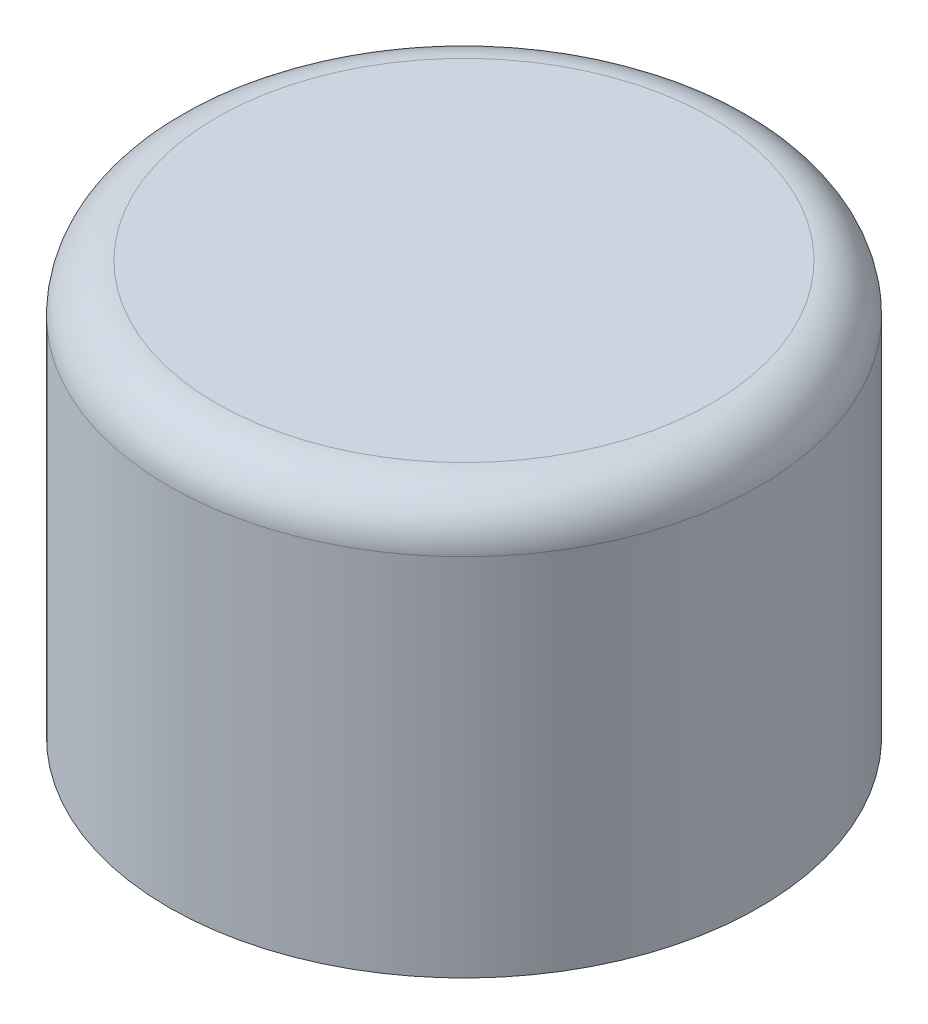
from build123d import *

# Parameters (mm, degrees)
SKETCH7_R           = 10.735
BASE_FLANGE1_DEPTH  = 1
SKETCH17_R          = 4
SKETCH17_R_2        = 2.5
BOSS_EXTRUDE1_DEPTH = 4


# Read off the part's stored shape, not the designer's step: Edge-Flange1
# Sheet-metal steps are written as plain solids
with BuildPart() as part:
    # Sketch7 → Base-Flange1 (new body)
    with BuildSketch(Plane(origin=(0, 0, 0), x_dir=(1, 0, 0), z_dir=(0, 1, 0))):
        with Locations(Location((0, 0, 0), (0, 0, 270))):
            Circle(SKETCH7_R)
    extrude(amount=-BASE_FLANGE1_DEPTH)

    # Edge-Flange1 outline → Edge-Flange1 (revolve, cut)
    with BuildSketch(Plane.XY):
        with BuildLine():
            Line((10.57104109, -1), (10.735, -1))
            Line((10.735, -1), (10.735, 0))
            Line((10.735, 0), (8.9984, 0))
            ThreePointArc((8.9984, 0), (9.930226164, -0.271171885), (10.57104109, -1))
        make_face()
    revolve(axis=Axis((0, 0, 0), (0, 1, 0)), mode=Mode.SUBTRACT)

    # Edge-Flange1 2 outline → Edge-Flange1 2 (revolve)
    with BuildSketch(Plane.XY):
        with BuildLine():
            Line((9.735, -1.7366), (9.735, -15))
            Line((9.735, -15), (10.735, -15))
            Line((10.735, -15), (10.735, -1.7366))
            ThreePointArc((10.735, -1.7366), (10.693514757, -1.359286442), (10.57104109, -1))
            Line((10.57104109, -1), (8.9984, -1))
            ThreePointArc((8.9984, -1), (9.519254855, -1.215745145), (9.735, -1.7366))
        make_face()
    revolve(axis=Axis((0, 0, 0), (0, 1, 0)))

    # Sketch17 → Boss-Extrude1 (add)
    with BuildSketch(Plane.XZ.offset(1)):
        with Locations(Location((0, 0, 0), (0, 0, 90))):
            Circle(SKETCH17_R)
        with Locations(Location((0, 0, 0), (0, 0, 270))):
            Circle(SKETCH17_R_2, mode=Mode.SUBTRACT)
    extrude(amount=BOSS_EXTRUDE1_DEPTH)


solid = part.part
